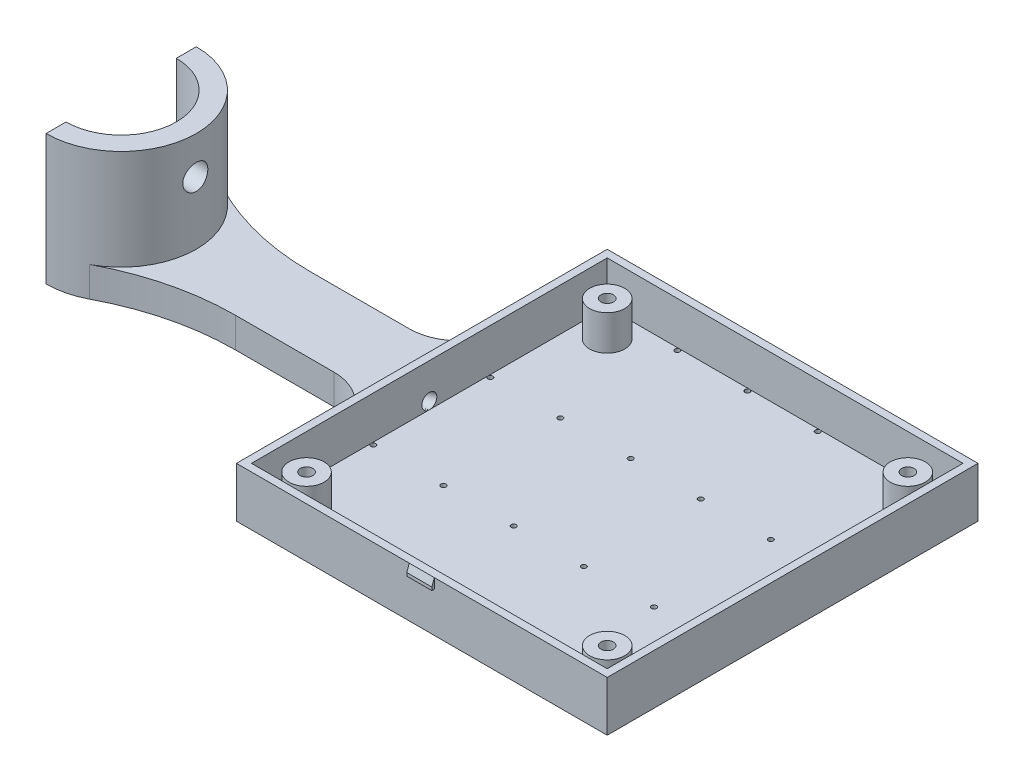
from build123d import *

# Parameters (mm, degrees)
SKETCH_1_W                  = 74
SKETCH_1_H                  = 74
EXTRUDE_1_DEPTH             = 10
SKETCH_2_W                  = 71
SKETCH_2_H                  = 71
CUT_EXTRUDE_1_DEPTH         = 8.5
SKETCH_3_R                  = 3.5
EXTRUDE_2_DEPTH             = 7
SKETCH_4_R                  = 1.25
CUT_EXTRUDE_2_DEPTH         = 7
SKETCH_5_W                  = 5
SKETCH_5_H                  = 2
EXTRUDE_3_DEPTH             = 0.5
CHAMFER_1_SIZE              = 0.5
CHAMFER_1_SIZE2             = 1.37373871
CHAMFER_1_OF_MIRROR_1_SIZE2 = 1.37373871
CHAMFER_1_OF_MIRROR_1_SIZE  = 0.5
SKETCH_6_W                  = 15
SKETCH_6_H                  = 6
EXTRUDE_4_DEPTH             = 60
FILLET_1_R                  = 10
SKETCH_8_R                  = 15
EXTRUDE_5_DEPTH             = 20
EXTRUDE_5_DIRECTION_2_REACH = 106.169
SKETCH_9_W                  = 15
SKETCH_9_H                  = 30
CUT_EXTRUDE_3_DEPTH         = 121.939034228
SKETCH_10_R                 = 11
CUT_EXTRUDE_4_DEPTH         = 108.197248099
FILLET_2_R                  = 50
CUT_EXTRUDE_5_DEPTH         = 155.477344617
CUT_EXTRUDE_5_DEPTH_BACK    = 155.477344617
SKETCH_11_R                 = 2.5
SWEEP_START                 = -53
SWEEP_1_DEPTH               = 17.335664095
SKETCH_18_R                 = 0.5
CUT_EXTRUDE_7_DEPTH         = 107.843343379


with BuildPart() as part:
    # Эскиз1 → Бобышка-Вытянуть1 (new body)
    with BuildSketch(Plane(origin=(0, 0, 0), x_dir=(1, 0, 0), z_dir=(0, 1, 0))):
        Rectangle(SKETCH_1_W, SKETCH_1_H)
    extrude(amount=-EXTRUDE_1_DEPTH)

    # Эскиз2 → Вырез-Вытянуть1 (cut)
    with BuildSketch(Plane(origin=(0, 0, 0), x_dir=(1, 0, 0), z_dir=(0, 1, 0))):
        Rectangle(SKETCH_2_W, SKETCH_2_H)
    extrude(amount=-CUT_EXTRUDE_1_DEPTH, mode=Mode.SUBTRACT)

    # Эскиз3 → Бобышка-Вытянуть2 (add)
    with BuildSketch(Plane(origin=(0, -8.5, 0), x_dir=(1, 0, 0), z_dir=(0, 1, 0))):
        with Locations(Location((-30, 30, 0), (0, 0, 270))):
            Circle(SKETCH_3_R)
        with Locations(Location((30, 30, 0), (0, 0, 90))):
            Circle(SKETCH_3_R)
        with Locations(Location((30, -30, 0), (0, 0, 270))):
            Circle(SKETCH_3_R)
        with Locations(Location((-30, -30, 0), (0, 0, 90))):
            Circle(SKETCH_3_R)
    extrude(amount=EXTRUDE_2_DEPTH)

    # Эскиз4 → Вырез-Вытянуть2 (cut)
    with BuildSketch(Plane(origin=(0, -1.5, 0), x_dir=(1, 0, 0), z_dir=(0, 1, 0))):
        with Locations(Location((-30, 30, 0), (0, 0, 270))):
            Circle(SKETCH_4_R)
        with Locations(Location((-30, -30, 0), (0, 0, 270))):
            Circle(SKETCH_4_R)
        with Locations(Location((30, 30, 0), (0, 0, 270))):
            Circle(SKETCH_4_R)
        with Locations(Location((30, -30, 0), (0, 0, 270))):
            Circle(SKETCH_4_R)
    extrude(amount=-CUT_EXTRUDE_2_DEPTH, mode=Mode.SUBTRACT)

    # Эскиз5 → Бобышка-Вытянуть3 (add)
    with BuildSketch(Plane.XY.offset(37)):
        with Locations((0, -1)):
            Rectangle(SKETCH_5_W, SKETCH_5_H)
    extrude_3 = extrude(amount=EXTRUDE_3_DEPTH)

    # Фаска1
    chamfer_1_edges = [part.edges().sort_by_distance(p)[0] for p in [
        (0, 0, 37.5),
    ]]
    chamfer_1_side = [part.faces().sort_by_distance(p)[0] for p in [
        (0, 0, -35.949940478),
    ]]
    chamfer(chamfer_1_edges, length=CHAMFER_1_SIZE, length2=CHAMFER_1_SIZE2, reference=chamfer_1_side[0])

    # Зеркальное отражение1: Бобышка-Вытянуть3 across plane
    add(extrude_3.mirror(Plane.XY))

    # Фаска1 of Зеркальное отражение1
    chamfer_1_of_mirror_1_edges = [part.edges().sort_by_distance(p)[0] for p in [
        (0, 0, -37.5),
    ]]
    chamfer(chamfer_1_of_mirror_1_edges, length=CHAMFER_1_OF_MIRROR_1_SIZE, length2=CHAMFER_1_OF_MIRROR_1_SIZE2)

    # Эскиз6 → Бобышка-Вытянуть4 (add)
    with BuildSketch(Plane.ZY.offset(37)):
        with Locations((0, -7)):
            Rectangle(SKETCH_6_W, SKETCH_6_H)
    extrude(amount=EXTRUDE_4_DEPTH)

    # Скругление1
    fillet_1_edges = [part.edges().sort_by_distance(p)[0] for p in [
        (-37, -7, 7.5),
        (-37, -7, -7.5),
    ]]
    fillet(fillet_1_edges, radius=FILLET_1_R)

    # Эскиз8 → Бобышка-Вытянуть5 (add)
    with BuildSketch(Plane(origin=(0, -4, 0), x_dir=(0, 0, -1), z_dir=(0, 1, 0))):
        with Locations(Location((0, 97, 0), (0, 0, 180))):
            Circle(SKETCH_8_R)
    extrude(amount=EXTRUDE_5_DEPTH)

    # Бобышка-Вытянуть5 direction 2: up to this face of the body (flat: up to its plane)
    extrude_5_direction_2_end = Plane(part.part.faces().sort_by_distance((-9.656440707, -10, 0))[0])
    # Эскиз8 → Бобышка-Вытянуть5 direction 2 (add, up to the picked face)
    with BuildSketch(Plane(origin=(0, -4, 0), x_dir=(0, 0, -1), z_dir=(0, 1, 0)), mode=Mode.PRIVATE) as extrude_5_direction_2_sk1:
        with Locations(Location((0, 97, 0), (0, 0, 180))):
            Circle(SKETCH_8_R)
    extrude_5_direction_2_tool1 = split(extrude(extrude_5_direction_2_sk1.sketch, amount=-EXTRUDE_5_DIRECTION_2_REACH, mode=Mode.PRIVATE), bisect_by=extrude_5_direction_2_end, keep=Keep.BOTH, mode=Mode.PRIVATE)
    add(extrude_5_direction_2_tool1.solids().sort_by(Axis((-97, -4, 0), (0, -1, 0)))[0])

    # Эскиз9 → Вырез-Вытянуть3 (cut, through all)
    with BuildSketch(Plane(origin=(0, 16, 0), x_dir=(1, 0, 0), z_dir=(0, 1, 0))):
        with Locations((-104.5, 0)):
            Rectangle(SKETCH_9_W, SKETCH_9_H)
    extrude(amount=-CUT_EXTRUDE_3_DEPTH, mode=Mode.SUBTRACT)

    # Эскиз10 → Вырез-Вытянуть4 (cut, through all)
    with BuildSketch(Plane(origin=(0, 16, 0), x_dir=(1, 0, 0), z_dir=(0, 1, 0))):
        with Locations((-97, 0)):
            Circle(SKETCH_10_R)
    extrude(amount=-CUT_EXTRUDE_4_DEPTH, mode=Mode.SUBTRACT)

    # Скругление2
    fillet_2_edges = [part.edges().sort_by_distance(p)[0] for p in [
        (-84.009618943, -7, -7.5),
        (-84.009618943, -7, 7.5),
    ]]
    fillet(fillet_2_edges, radius=FILLET_2_R)

    # Эскиз11 → Вырез-Вытянуть5 (cut, two sides: drawn at the far end of the back side and taken through both)
    with BuildSketch(Plane(origin=(-112, 0, 0), x_dir=(0, 0, 1), z_dir=(1, 0, 0)).offset(-CUT_EXTRUDE_5_DEPTH_BACK)):
        with Locations((0, -8.5)):
            Circle(SKETCH_11_R)
    extrude(amount=CUT_EXTRUDE_5_DEPTH + CUT_EXTRUDE_5_DEPTH_BACK, mode=Mode.SUBTRACT)

    # Вырез-По траектории1: read off the stored shape, not the designer's step
    # Вырез-По траектории1 outline → Вырез-По траектории1 (cut)
    with BuildSketch(Plane(origin=(0, 0, 0), x_dir=(-0.27037806600999104, 0.962753255180235, -0.0013678671566966505), z_dir=(0.9627409348714416, 0.27038152606985083, 0.004870593701078593)).offset(SWEEP_START)):
        with BuildLine():
            add(Edge.make_bspline(
                [(2.861200358, -1.320385383), (5.749460123, -1.320385383), (5.745356522, 1.679576226), (2.857096756, 1.679576226), (-0.031163009, 1.679576226), (-0.027059408, -1.320385383), (2.861200358, -1.320385383)],
                knots=[0, 0, 0, 0, 0.5, 0.5, 0.5, 1, 1, 1, 1], degree=3, weights=[1, 0.333333333, 0.333333333, 1, 0.333333333, 0.333333333, 1]))
        make_face()
    extrude(amount=SWEEP_1_DEPTH, mode=Mode.SUBTRACT)

    # Эскиз18 → Вырез-Вытянуть7 (cut, through all)
    with BuildSketch(Plane(origin=(0, -8.5, 0), x_dir=(1, 0, 0), z_dir=(0, 1, 0))):
        with Locations(Location((-35, 35, 0), (0, 0, 270))):
            Circle(SKETCH_18_R)
        with Locations(Location((-21, 35, 0), (0, 0, 270))):
            Circle(SKETCH_18_R)
        with Locations(Location((-7, 35, 0), (0, 0, 270))):
            Circle(SKETCH_18_R)
        with Locations(Location((7, 35, 0), (0, 0, 270))):
            Circle(SKETCH_18_R)
        with Locations(Location((21, 35, 0), (0, 0, 270))):
            Circle(SKETCH_18_R)
        with Locations(Location((35, 35, 0), (0, 0, 270))):
            Circle(SKETCH_18_R)
        with Locations(Location((-21, 11.666666667, 0), (0, 0, 270))):
            Circle(SKETCH_18_R)
        with Locations(Location((-7, 11.666666667, 0), (0, 0, 270))):
            Circle(SKETCH_18_R)
        with Locations(Location((7, 11.666666667, 0), (0, 0, 270))):
            Circle(SKETCH_18_R)
        with Locations(Location((21, 11.666666667, 0), (0, 0, 270))):
            Circle(SKETCH_18_R)
        with Locations(Location((35, 11.666666667, 0), (0, 0, 270))):
            Circle(SKETCH_18_R)
        with Locations(Location((-21, -11.666666667, 0), (0, 0, 270))):
            Circle(SKETCH_18_R)
        with Locations(Location((-7, -11.666666667, 0), (0, 0, 270))):
            Circle(SKETCH_18_R)
        with Locations(Location((7, -11.666666667, 0), (0, 0, 270))):
            Circle(SKETCH_18_R)
        with Locations(Location((21, -11.666666667, 0), (0, 0, 270))):
            Circle(SKETCH_18_R)
        with Locations(Location((35, -11.666666667, 0), (0, 0, 270))):
            Circle(SKETCH_18_R)
        with Locations(Location((-21, -35, 0), (0, 0, 270))):
            Circle(SKETCH_18_R)
        with Locations(Location((-7, -35, 0), (0, 0, 270))):
            Circle(SKETCH_18_R)
        with Locations(Location((7, -35, 0), (0, 0, 270))):
            Circle(SKETCH_18_R)
        with Locations(Location((21, -35, 0), (0, 0, 270))):
            Circle(SKETCH_18_R)
        with Locations(Location((35, -35, 0), (0, 0, 270))):
            Circle(SKETCH_18_R)
        with Locations(Location((-35, 11.666666667, 0), (0, 0, 270))):
            Circle(SKETCH_18_R)
        with Locations(Location((-35, -11.666666667, 0), (0, 0, 270))):
            Circle(SKETCH_18_R)
        with Locations(Location((-35, -35, 0), (0, 0, 270))):
            Circle(SKETCH_18_R)
    extrude(amount=-CUT_EXTRUDE_7_DEPTH, mode=Mode.SUBTRACT)


solid = part.part
